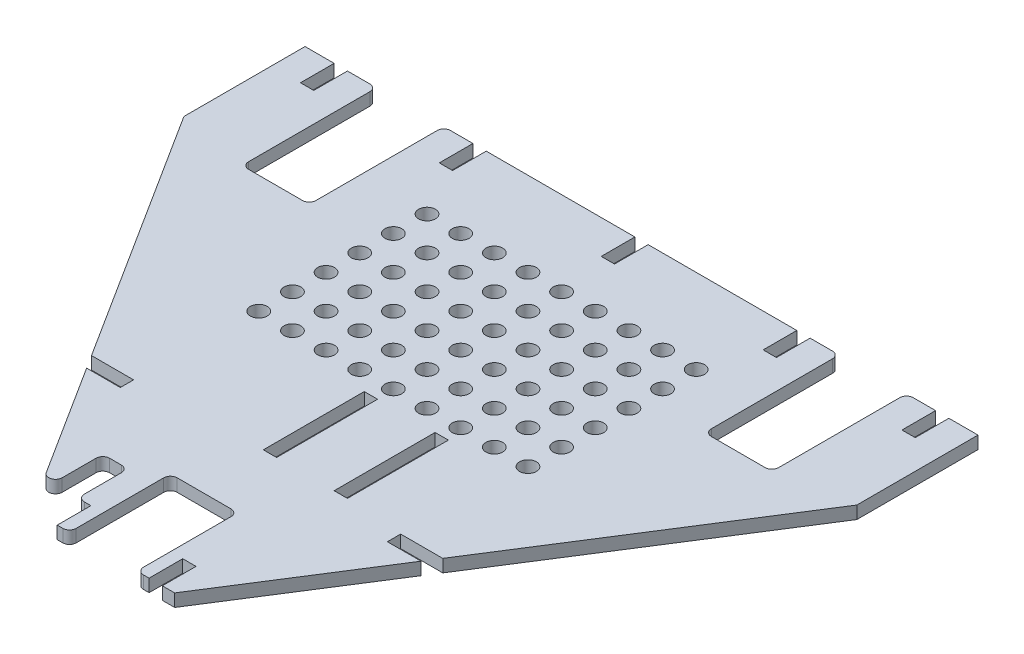
from build123d import *

# Parameters (mm, degrees)
BOSS_EXTRUDE1_DEPTH  = 4.7625
SKETCH2_W            = 5.0165
SKETCH2_H            = 38.1
SKETCH2_W_2          = 9.525
SKETCH2_H_2          = 31.75
CUT_EXTRUDE1_DEPTH   = 163.709069834
FILLET1_R            = 2.54
FILLET2_R            = 2.54
SKETCH3_R            = 3.175
CUT_EXTRUDE2_DEPTH   = 163.709069834
LPATTERN1_COUNT      = 9
LPATTERN1_PITCH      = 12.7
LPATTERN1_COUNT_DIR2 = 6
LPATTERN1_PITCH_DIR2 = 12.7
SKETCH4_W            = 15.885882056
SKETCH4_H            = 5.0165
SKETCH4_W_2          = 5.0165
SKETCH4_H_2          = 12.7
CUT_EXTRUDE3_DEPTH   = 163.709069834


with BuildPart() as part:
    # Sketch1 → Boss-Extrude1 (new body)
    with BuildSketch(Plane(origin=(0, 0, 0), x_dir=(1, 0, 0), z_dir=(0, 1, 0))):
        Polygon((12.7, -63.5), (-12.7, -63.5), (-12.7, -101.6), (-17.3355, -101.6), (-17.3355, -88.9), (-22.352, -88.9), (-22.352, -101.6), (-26.9875, -101.6), (-127, 55.88), (-127, 101.6), (-116.0145, 101.6), (-116.0145, 88.9), (-110.998, 88.9), (-110.998, 101.6), (-100.0125, 101.6), (-100.0125, 50.8), (-74.6125, 50.8), (-74.6125, 101.6), (-63.627, 101.6), (-63.627, 88.9), (-58.6105, 88.9), (-58.6105, 101.6), (58.6105, 101.6), (58.6105, 88.9), (63.627, 88.9), (63.627, 101.6), (74.6125, 101.6), (74.6125, 50.8), (100.0125, 50.8), (100.0125, 101.6), (110.998, 101.6), (110.998, 88.9), (116.0145, 88.9), (116.0145, 101.6), (127, 101.6), (127, 55.88), (26.9875, -101.6), (22.352, -101.6), (22.352, -88.9), (17.3355, -88.9), (17.3355, -101.6), (12.7, -101.6), align=None)
    extrude(amount=BOSS_EXTRUDE1_DEPTH)

    # Sketch2 → Cut-Extrude1 (cut, through all)
    with BuildSketch(Plane(origin=(0, 4.7625, 0), x_dir=(1, 0, 0), z_dir=(0, 1, 0))):
        with Locations((-0.53975, -19.05)):
            Rectangle(SKETCH2_W, SKETCH2_H)
        with Locations((-27.1145, -85.725)):
            Rectangle(SKETCH2_W_2, SKETCH2_H_2)
        with Locations((26.19375, -19.05)):
            Rectangle(SKETCH2_W, SKETCH2_H)
    extrude(amount=-CUT_EXTRUDE1_DEPTH, mode=Mode.SUBTRACT)

    # Fillet1
    fillet1_edges = [part.edges().sort_by_distance(p)[0] for p in [
        (-22.352, 2.38125, 88.9),
        (-31.877, 2.38125, 93.900977778),
        (-22.352, 2.38125, 69.85),
        (-31.877, 2.38125, 69.85),
    ]]
    fillet(fillet1_edges, radius=FILLET1_R)

    # Fillet2
    fillet2_edges = [part.edges().sort_by_distance(p)[0] for p in [
        (-12.7, 2.38125, 101.6),
        (12.7, 2.38125, 101.6),
        (12.7, 2.38125, 63.5),
        (-12.7, 2.38125, 63.5),
        (100.0125, 2.38125, -101.6),
        (100.0125, 2.38125, -50.8),
        (74.6125, 2.38125, -101.6),
        (74.6125, 2.38125, -50.8),
        (-100.0125, 2.38125, -101.6),
        (-74.6125, 2.38125, -101.6),
        (-74.6125, 2.38125, -50.8),
        (-100.0125, 2.38125, -50.8),
    ]]
    fillet(fillet2_edges, radius=FILLET2_R)

    # Sketch3 → Cut-Extrude2 (cut, through all)
    with BuildSketch(Plane(origin=(0, 4.7625, 0), x_dir=(1, 0, 0), z_dir=(0, 1, 0))):
        with Locations((-49.2125, 69.85)):
            Circle(SKETCH3_R)
    cut_extrude2 = extrude(amount=-CUT_EXTRUDE2_DEPTH, mode=Mode.SUBTRACT)

    # LPattern1: Cut-Extrude2 9 × 6
    with Locations(*[(i * LPATTERN1_PITCH, 0, j * LPATTERN1_PITCH_DIR2) for i in range(LPATTERN1_COUNT) for j in range(LPATTERN1_COUNT_DIR2) if (i, j) != (0, 0)]):
        add(cut_extrude2, mode=Mode.SUBTRACT)

    # Sketch4 → Cut-Extrude3 (cut, through all)
    with BuildSketch(Plane(origin=(0, 4.7625, 0), x_dir=(1, 0, 0), z_dir=(0, 1, 0))):
        with Locations((58.347941028, -42.221019841)):
            Rectangle(SKETCH4_W, SKETCH4_H)
        with Locations((-58.347941028, -42.221019841)):
            Rectangle(SKETCH4_W, SKETCH4_H)
        with Locations((0, 95.25)):
            Rectangle(SKETCH4_W_2, SKETCH4_H_2)
    extrude(amount=-CUT_EXTRUDE3_DEPTH, mode=Mode.SUBTRACT)


solid = part.part
